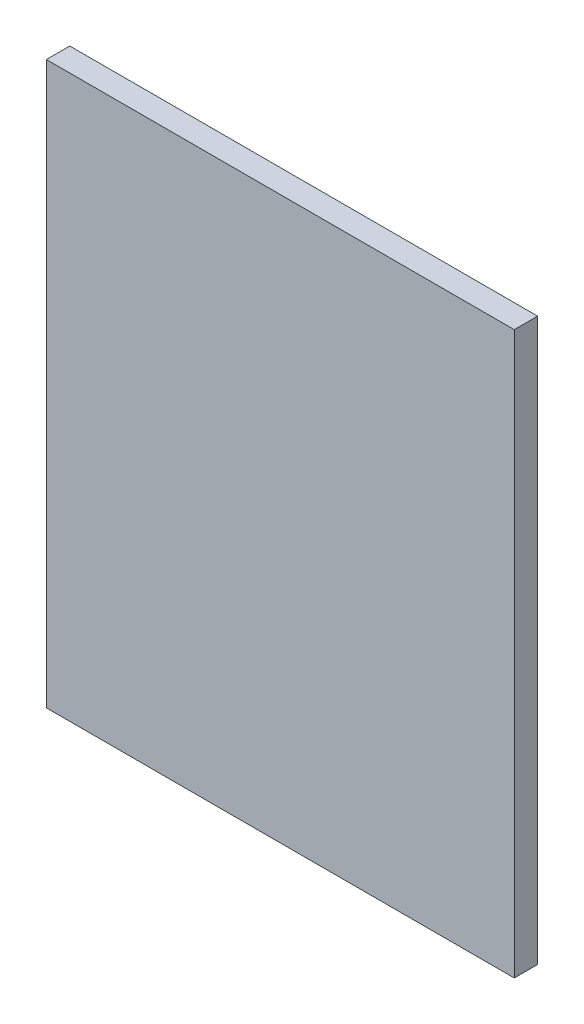
from build123d import *

# Parameters (mm, degrees)
SKETCH1_W           = 127
SKETCH1_H           = 152.4
BOSS_EXTRUDE1_DEPTH = 6.35


with BuildPart() as part:
    # Sketch1 → Boss-Extrude1 (new body)
    with BuildSketch(Plane.XY):
        with Locations((4.466360856, 35.459021407)):
            Rectangle(SKETCH1_W, SKETCH1_H)
    extrude(amount=BOSS_EXTRUDE1_DEPTH)


solid = part.part
